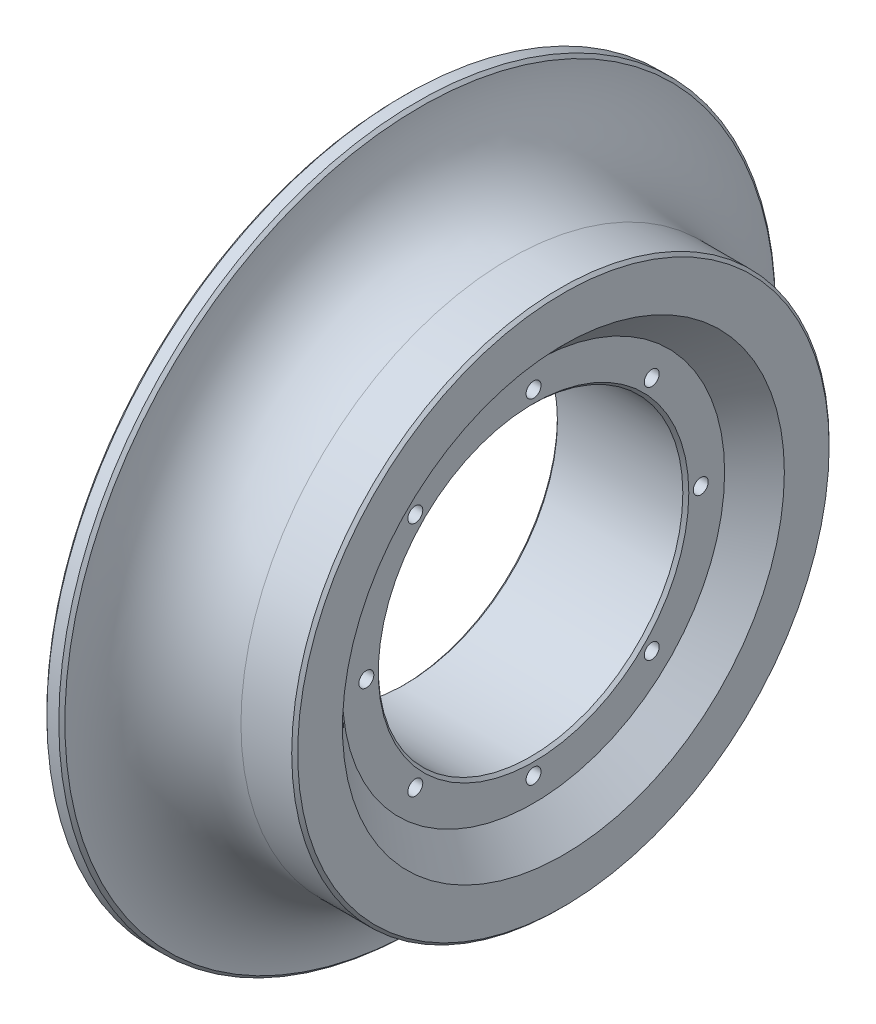
from build123d import *

# Parameters (mm, degrees)
SZKIC2_R                   = 2.5
WYTNIJ_WYCI_GNI_CIE1_DEPTH = 179.089864929


with BuildPart() as part:
    # Szkic1 → Obrót1 (revolve)
    with BuildSketch(Plane.XY):
        with BuildLine():
            Line((-20.999999954, 51), (20.999999954, 51))
            Line((20.999999954, 51), (21.999999954, 52))
            Line((21.999999954, 52), (21.999999954, 64))
            Line((21.999999954, 64), (31.999999954, 74))
            Line((31.999999954, 74), (31.999999954, 89))
            Line((31.999999954, 89), (30.999999954, 90))
            Line((30.999999954, 90), (13.999999954, 90))
            ThreePointArc((13.999999954, 90), (-6.850449034, 98.430142019), (-15.982748316, 118.982748358))
            Line((-15.982748316, 118.982748358), (-16.999999958, 120))
            Line((-16.999999958, 120), (-20.999999958, 120))
            Line((-20.999999958, 120), (-21.999999957, 119.000000001))
            Line((-21.999999957, 119.000000001), (-21.999999957, 52.000000003))
            Line((-21.999999957, 52.000000003), (-20.999999954, 51))
        make_face()
    revolve(axis=Axis((0, 0, 0), (-1, 0, 0)))

    # Szkic2 → Wytnij-wyciągnięcie1 (cut, through all)
    with BuildSketch(Plane.ZY.offset(21.999999957)):
        with Locations((0, 56)):
            Circle(SZKIC2_R)
        with Locations((39.597979746, 39.597979746)):
            Circle(SZKIC2_R)
        with Locations((56, 0)):
            Circle(SZKIC2_R)
        with Locations((39.597979746, -39.597979746)):
            Circle(SZKIC2_R)
        with Locations((0, -56)):
            Circle(SZKIC2_R)
        with Locations((-39.597979746, -39.597979746)):
            Circle(SZKIC2_R)
        with Locations((-56, 0)):
            Circle(SZKIC2_R)
        with Locations((-39.597979746, 39.597979746)):
            Circle(SZKIC2_R)
    extrude(amount=-WYTNIJ_WYCI_GNI_CIE1_DEPTH, mode=Mode.SUBTRACT)


solid = part.part
